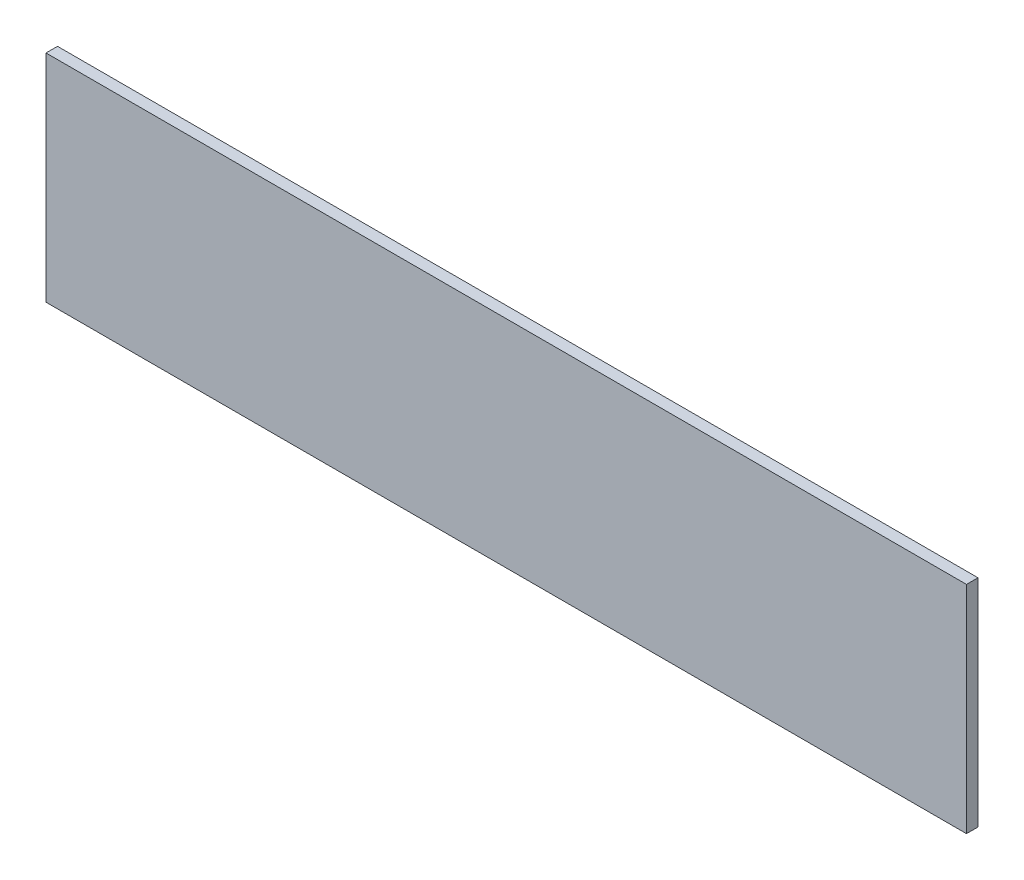
from build123d import *

# Parameters (mm, degrees)
SKETCH1_W           = 240
SKETCH1_H           = 56.287144042
BOSS_EXTRUDE1_DEPTH = 3


with BuildPart() as part:
    # Sketch1 → Boss-Extrude1 (new body)
    with BuildSketch(Plane.XY):
        Rectangle(SKETCH1_W, SKETCH1_H)
    extrude(amount=BOSS_EXTRUDE1_DEPTH)


solid = part.part
